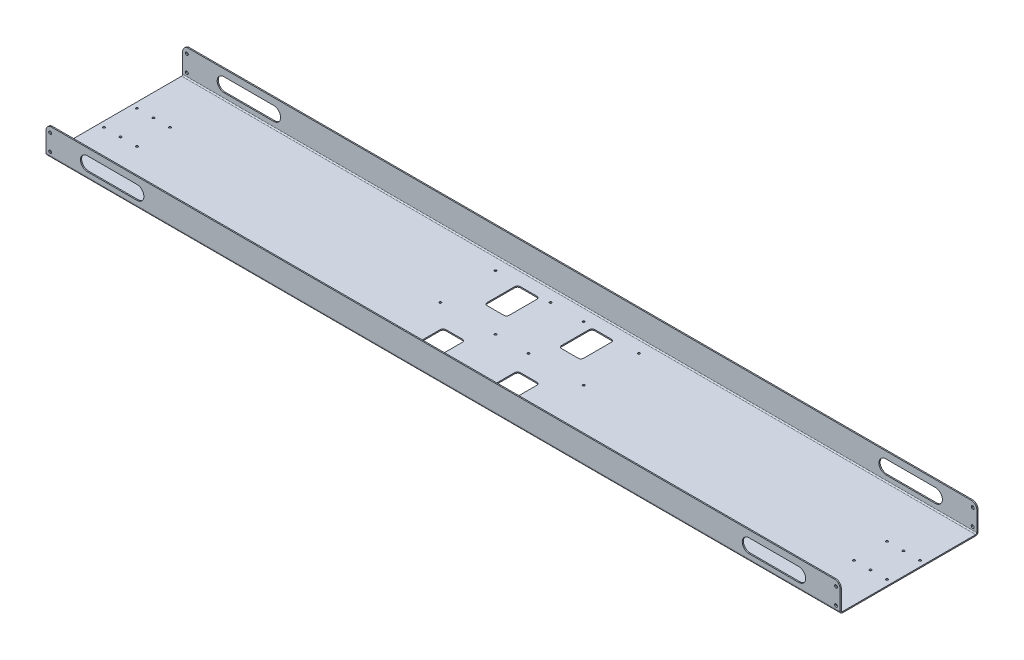
from build123d import *

# Parameters (mm, degrees)
SKETCH1_W                        = 1828.8
SKETCH1_H                        = 317.5
BOSS_EXTRUDE1_DEPTH              = 2.65684
CUT_EXTRUDE1_DEPTH               = 929.081882863
SKETCH3_R                        = 2.3876
CUT_EXTRUDE2_DEPTH               = 929.081882863
LPATTERN1_COUNT                  = 2
LPATTERN1_PITCH                  = 203.2
F_10_0_1935_DIAMETER_HOLE1_D     = 4.9149
F_10_0_1935_DIAMETER_HOLE1_DEPTH = 2.65684
F_10_0_1935_DIAMETER_HOLE2_D     = 4.9149
EDGE_FLANGE1_STRIP_W             = 15.94104
EDGE_FLANGE1_STRIP_H             = 2.65684
EDGE_FLANGE1_STRIP_CUT_DEPTH     = 1828.8
EDGE_FLANGE1_DEPTH               = 1828.8
EDGE_FLANGE2_STRIP_W             = 15.94104
EDGE_FLANGE2_STRIP_H             = 2.65684
EDGE_FLANGE2_STRIP_CUT_DEPTH     = 1828.8
EDGE_FLANGE2_DEPTH               = 1828.8
FILLET1_R                        = 12.7
CUT_EXTRUDE3_DEPTH               = 971.03394786
F_1_4_CLEARANCE_HOLE1_D          = 6.7564


# Sheet-metal steps are written as plain solids
with BuildPart() as part:
    # Sketch1 → Boss-Extrude1 (new body)
    with BuildSketch(Plane(origin=(0, 0, 0), x_dir=(1, 0, 0), z_dir=(0, 1, 0))):
        Rectangle(SKETCH1_W, SKETCH1_H)
    extrude(amount=BOSS_EXTRUDE1_DEPTH)

    # Sketch2 → Cut-Extrude1 (cut, through all)
    with BuildSketch(Plane(origin=(0, 2.65684, 0), x_dir=(1, 0, 0), z_dir=(0, 1, 0))):
        with BuildLine():
            Line((-104.775, 123.825), (-66.675, 123.825))
            ThreePointArc((-66.675, 123.825), (-62.184871939, 121.965128061), (-60.325, 117.475))
            Line((-60.325, 117.475), (-60.325, 53.975))
            ThreePointArc((-60.325, 53.975), (-62.184871939, 49.484871939), (-66.675, 47.625))
            Line((-66.675, 47.625), (-104.775, 47.625))
            ThreePointArc((-104.775, 47.625), (-109.265128061, 49.484871939), (-111.125, 53.975))
            Line((-111.125, 53.975), (-111.125, 117.475))
            ThreePointArc((-111.125, 117.475), (-109.265128061, 121.965128061), (-104.775, 123.825))
        make_face()
        with BuildLine():
            Line((-104.775, -47.625), (-66.675, -47.625))
            ThreePointArc((-66.675, -47.625), (-62.184871939, -49.484871939), (-60.325, -53.975))
            Line((-60.325, -53.975), (-60.325, -117.475))
            ThreePointArc((-60.325, -117.475), (-62.184871939, -121.965128061), (-66.675, -123.825))
            Line((-66.675, -123.825), (-104.775, -123.825))
            ThreePointArc((-104.775, -123.825), (-109.265128061, -121.965128061), (-111.125, -117.475))
            Line((-111.125, -117.475), (-111.125, -53.975))
            ThreePointArc((-111.125, -53.975), (-109.265128061, -49.484871939), (-104.775, -47.625))
        make_face()
        with BuildLine():
            Line((66.675, -47.625), (104.775, -47.625))
            ThreePointArc((104.775, -47.625), (109.265128061, -49.484871939), (111.125, -53.975))
            Line((111.125, -53.975), (111.125, -117.475))
            ThreePointArc((111.125, -117.475), (109.265128061, -121.965128061), (104.775, -123.825))
            Line((104.775, -123.825), (66.675, -123.825))
            ThreePointArc((66.675, -123.825), (62.184871939, -121.965128061), (60.325, -117.475))
            Line((60.325, -117.475), (60.325, -53.975))
            ThreePointArc((60.325, -53.975), (62.184871939, -49.484871939), (66.675, -47.625))
        make_face()
        with BuildLine():
            Line((104.775, 123.825), (66.675, 123.825))
            ThreePointArc((66.675, 123.825), (62.184871939, 121.965128061), (60.325, 117.475))
            Line((60.325, 117.475), (60.325, 53.975))
            ThreePointArc((60.325, 53.975), (62.184871939, 49.484871939), (66.675, 47.625))
            Line((66.675, 47.625), (104.775, 47.625))
            ThreePointArc((104.775, 47.625), (109.265128061, 49.484871939), (111.125, 53.975))
            Line((111.125, 53.975), (111.125, 117.475))
            ThreePointArc((111.125, 117.475), (109.265128061, 121.965128061), (104.775, 123.825))
        make_face()
    extrude(amount=-CUT_EXTRUDE1_DEPTH, mode=Mode.SUBTRACT)

    # Sketch3 → Cut-Extrude2 (cut, through all)
    with BuildSketch(Plane(origin=(0, 2.65684, 0), x_dir=(1, 0, 0), z_dir=(0, 1, 0))):
        with Locations(Location((-165.1, 127, 0), (0, 0, 270))):
            Circle(SKETCH3_R)
        with Locations(Location((-165.1, 0, 0), (0, 0, 270))):
            Circle(SKETCH3_R)
        with Locations(Location((-165.1, -127, 0), (0, 0, 270))):
            Circle(SKETCH3_R)
        with Locations(Location((-38.1, 127, 0), (0, 0, 270))):
            Circle(SKETCH3_R)
        with Locations(Location((-38.1, 0, 0), (0, 0, 270))):
            Circle(SKETCH3_R)
        with Locations(Location((-38.1, -127, 0), (0, 0, 270))):
            Circle(SKETCH3_R)
    cut_extrude2 = extrude(amount=-CUT_EXTRUDE2_DEPTH, mode=Mode.SUBTRACT)

    # LPattern1: Cut-Extrude2 ×2
    with Locations(*[(i * LPATTERN1_PITCH, 0, 0) for i in range(1, LPATTERN1_COUNT)]):
        add(cut_extrude2, mode=Mode.SUBTRACT)

    # #10 (0.1935) Diameter Hole1
    with Locations(Plane(origin=(0, 2.65684, 0), x_dir=(1, 0, 0), z_dir=(0, 1, 0))):
        with Locations((165.1, 127), (38.1, 127), (-38.1, 127), (165.1, 0), (165.1, -127), (-38.1, 0), (38.1, 0), (38.1, -127), (-38.1, -127), (-165.1, -127), (-165.1, 0), (-165.1, 127)):
            Hole(F_10_0_1935_DIAMETER_HOLE1_D / 2, depth=F_10_0_1935_DIAMETER_HOLE1_DEPTH)

    # #10 (0.1935) Diameter Hole2 (through all)
    with Locations(Plane(origin=(0, 2.65684, 0), x_dir=(1, 0, 0), z_dir=(0, 1, 0))):
        with Locations((901.7, 38.1), (863.6, 38.1), (825.5, 38.1), (825.5, -38.1), (863.6, -38.1), (901.7, -38.1)):
            f_10_0_1935_diameter_hole2 = Hole(F_10_0_1935_DIAMETER_HOLE2_D / 2)

    # Mirror1: #10 (0.1935) Diameter Hole2 across plane
    add(f_10_0_1935_diameter_hole2.mirror(Plane(origin=(0, 0, 0), x_dir=(0, 0, 1), z_dir=(1, 0, 0))), mode=Mode.SUBTRACT)

    # Edge-Flange1 strip (across the edge) → Edge-Flange1 strip cut (cut)
    with BuildSketch(Plane(origin=(914.4, 2.65684, -158.75), x_dir=(0, 0, 1), z_dir=(-1, 0, 0))):
        with Locations((-2.65684, -1.32842)):
            Rectangle(EDGE_FLANGE1_STRIP_W, EDGE_FLANGE1_STRIP_H)
    extrude(amount=EDGE_FLANGE1_STRIP_CUT_DEPTH, mode=Mode.SUBTRACT)

    # Edge-Flange1 section (across the edge) → Edge-Flange1 (add)
    with BuildSketch(Plane(origin=(914.4, 2.65684, -158.75), x_dir=(0, 0, 1), z_dir=(-1, 0, 0))):
        with BuildLine():
            Line((0, 2.65684), (0, 60.84316))
            Line((0, 60.84316), (2.65684, 60.84316))
            Line((2.65684, 60.84316), (2.65684, 2.65684))
            ThreePointArc((2.65684, 2.65684), (3.435010419, 0.778170419), (5.31368, 0))
            Line((5.31368, 0), (5.31368, -2.65684))
            ThreePointArc((5.31368, -2.65684), (1.556340839, -1.100499161), (0, 2.65684))
        make_face()
    extrude(amount=EDGE_FLANGE1_DEPTH)

    # Edge-Flange2 strip (across the edge) → Edge-Flange2 strip cut (cut)
    with BuildSketch(Plane(origin=(-914.4, 2.65684, 158.75), x_dir=(0, 0, -1), z_dir=(1, 0, 0))):
        with Locations((-2.65684, -1.32842)):
            Rectangle(EDGE_FLANGE2_STRIP_W, EDGE_FLANGE2_STRIP_H)
    extrude(amount=EDGE_FLANGE2_STRIP_CUT_DEPTH, mode=Mode.SUBTRACT)

    # Edge-Flange2 section (across the edge) → Edge-Flange2 (add)
    with BuildSketch(Plane(origin=(-914.4, 2.65684, 158.75), x_dir=(0, 0, -1), z_dir=(1, 0, 0))):
        with BuildLine():
            Line((0, 2.65684), (0, 60.84316))
            Line((0, 60.84316), (2.65684, 60.84316))
            Line((2.65684, 60.84316), (2.65684, 2.65684))
            ThreePointArc((2.65684, 2.65684), (3.435010419, 0.778170419), (5.31368, 0))
            Line((5.31368, 0), (5.31368, -2.65684))
            ThreePointArc((5.31368, -2.65684), (1.556340839, -1.100499161), (0, 2.65684))
        make_face()
    extrude(amount=EDGE_FLANGE2_DEPTH)

    # Fillet1
    fillet1_edges = [part.edges().sort_by_distance(p)[0] for p in [
        (914.4, 63.5, -157.42158),
        (-914.4, 63.5, -157.42158),
        (-914.4, 63.5, 157.42158),
        (914.4, 63.5, 157.42158),
    ]]
    fillet(fillet1_edges, radius=FILLET1_R)

    # Sketch21 → Cut-Extrude3 (cut, through all)
    with BuildSketch(Plane.XY.offset(158.75)):
        with BuildLine():
            Line((-819.15, 47.625), (-704.85, 47.625))
            ThreePointArc((-704.85, 47.625), (-688.975, 31.75), (-704.85, 15.875))
            Line((-704.85, 15.875), (-819.15, 15.875))
            ThreePointArc((-819.15, 15.875), (-835.025, 31.75), (-819.15, 47.625))
        make_face()
    cut_extrude3 = extrude(amount=-CUT_EXTRUDE3_DEPTH, mode=Mode.SUBTRACT)

    # 1/4 Clearance Hole1 (through all)
    with Locations(Plane(origin=(0, 0, -158.75), x_dir=(-1, 0, 0), z_dir=(0, 0, -1))):
        with Locations((904.875, 50.8), (904.875, 12.7)):
            f_1_4_clearance_hole1 = Hole(F_1_4_CLEARANCE_HOLE1_D / 2)

    # Mirror2: Cut-Extrude3, 1/4 Clearance Hole1 across plane
    add(cut_extrude3.mirror(Plane(origin=(0, 0, 0), x_dir=(0, 0, 1), z_dir=(1, 0, 0))), mode=Mode.SUBTRACT)
    add(f_1_4_clearance_hole1.mirror(Plane(origin=(0, 0, 0), x_dir=(0, 0, 1), z_dir=(1, 0, 0))), mode=Mode.SUBTRACT)


solid = part.part
